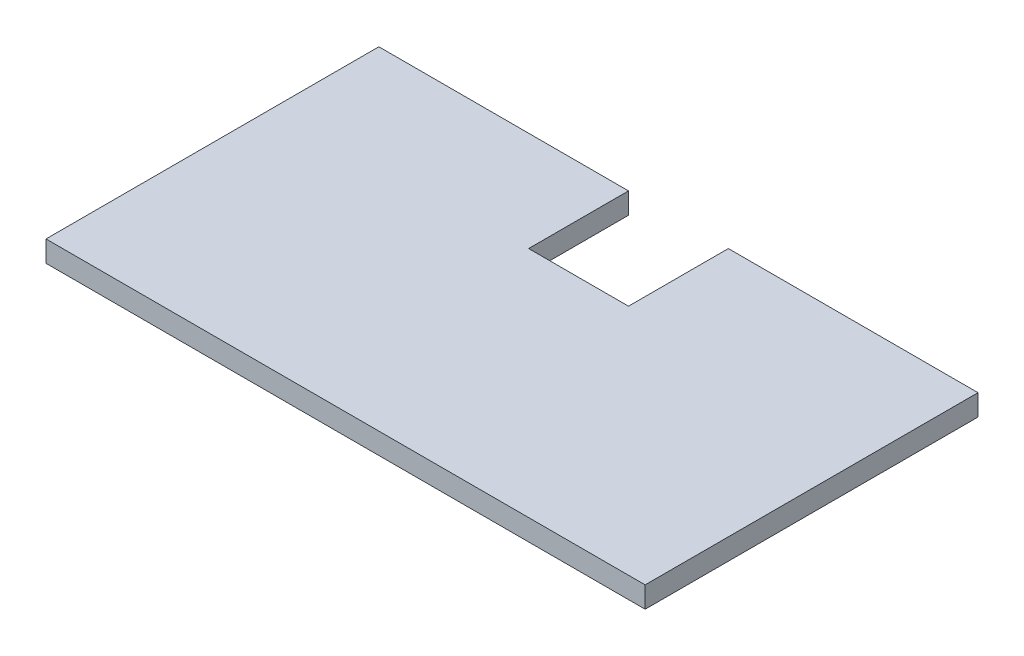
from build123d import *

# Parameters (mm, degrees)
SKETCH1_W           = 90
SKETCH1_H           = 50
BOSS_EXTRUDE1_DEPTH = 3.175
SKETCH2_W           = 15
SKETCH2_H           = 15
CUT_EXTRUDE1_DEPTH  = 52.575969453


with BuildPart() as part:
    # Sketch1 → Boss-Extrude1 (new body)
    with BuildSketch(Plane(origin=(0, 0, 0), x_dir=(1, 0, 0), z_dir=(0, 1, 0))):
        Rectangle(SKETCH1_W, SKETCH1_H)
    extrude(amount=BOSS_EXTRUDE1_DEPTH)

    # Sketch2 → Cut-Extrude1 (cut, through all)
    with BuildSketch(Plane(origin=(0, 3.175, 0), x_dir=(1, 0, 0), z_dir=(0, 1, 0))):
        with Locations((0, 17.5)):
            Rectangle(SKETCH2_W, SKETCH2_H)
    extrude(amount=-CUT_EXTRUDE1_DEPTH, mode=Mode.SUBTRACT)


solid = part.part
